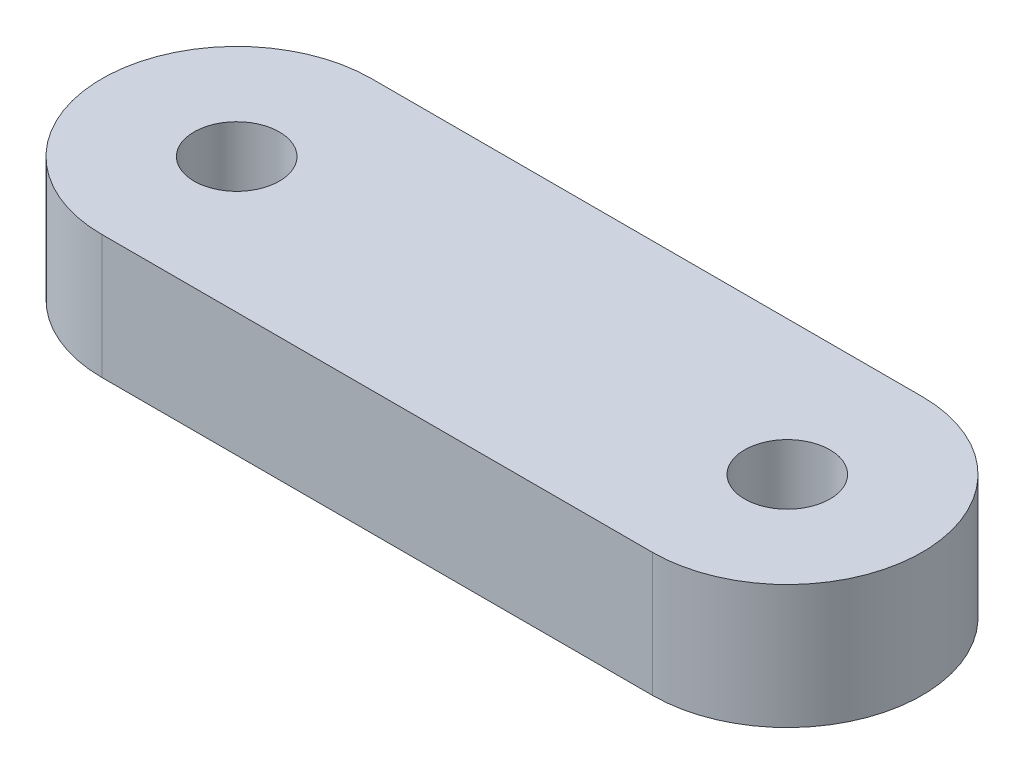
from build123d import *

# Parameters (mm, degrees)
SKETCH1_R           = 1.55
BOSS_EXTRUDE1_DEPTH = 4.5


with BuildPart() as part:
    # Sketch1 → Boss-Extrude1 (new body)
    with BuildSketch(Plane(origin=(0, 0, 0), x_dir=(1, 0, 0), z_dir=(0, 1, 0))):
        with BuildLine():
            Line((-10.000000241, 4.9), (10.000000241, 4.9))
            ThreePointArc((10.000000241, 4.9), (14.9, 0), (10.000000241, -4.9))
            Line((10.000000241, -4.9), (-10.000000241, -4.9))
            ThreePointArc((-10.000000241, -4.9), (-14.9, 0), (-10.000000241, 4.9))
        make_face()
        with Locations((-10, 0)):
            Circle(SKETCH1_R, mode=Mode.SUBTRACT)
        with Locations((10, 0)):
            Circle(SKETCH1_R, mode=Mode.SUBTRACT)
    extrude(amount=BOSS_EXTRUDE1_DEPTH)


solid = part.part
